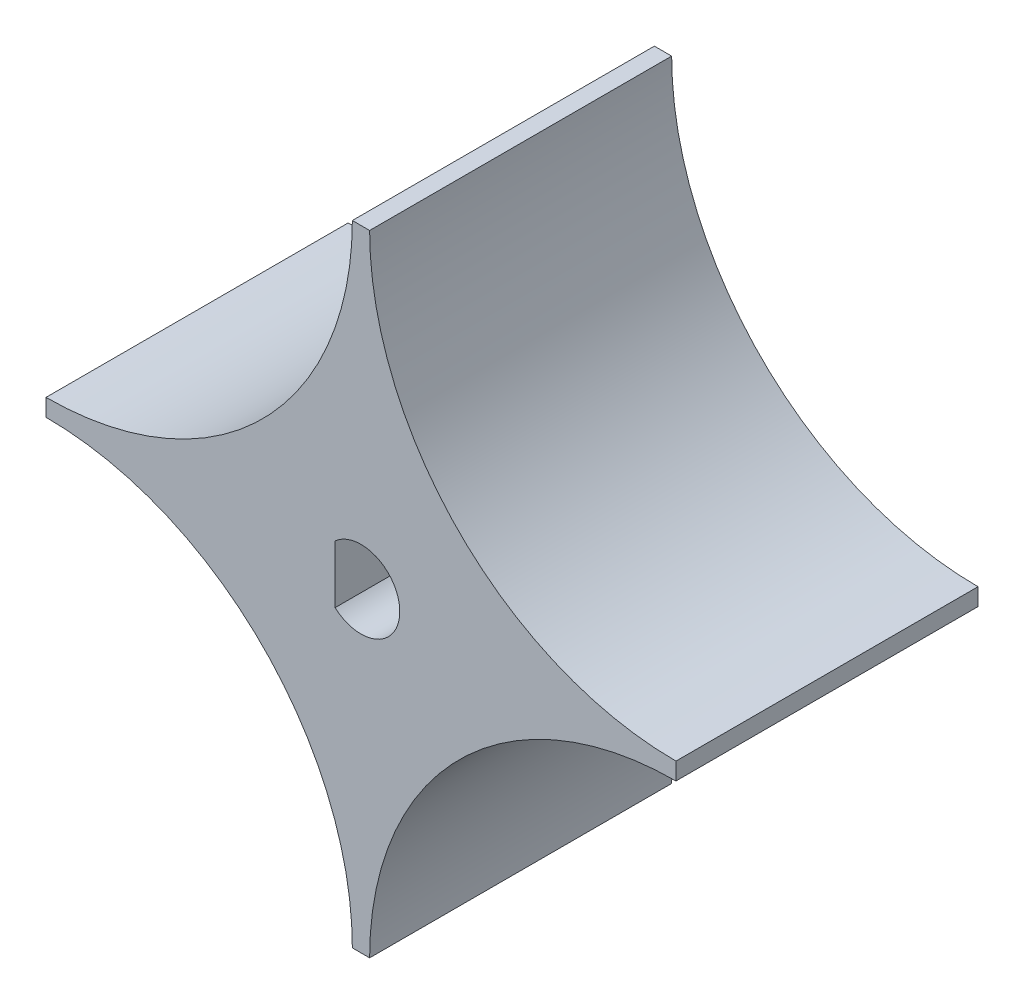
from build123d import *

# Parameters (mm, degrees)
BOSS_EXTRUDE2_DEPTH = 33
CUT_EXTRUDE1_DEPTH  = 10
CUT_EXTRUDE2_START  = -10
CUT_EXTRUDE2_DEPTH  = 10
BOSS_EXTRUDE3_START = 2
BOSS_EXTRUDE3_DEPTH = 2


with BuildPart() as part:
    # Sketch4 → Boss-Extrude2 (new body)
    with BuildSketch(Plane.XY):
        with BuildLine():
            Line((-23.886710504, -14.723007323), (-23.886710504, -16.723007323))
            ThreePointArc((-23.886710504, -16.723007323), (1.215580228, -27.120716591), (11.613289496, -52.223007323))
            Line((11.613289496, -52.223007323), (13.613289496, -52.223007323))
            ThreePointArc((13.613289496, -52.223007323), (24.010998764, -27.120716591), (49.113289496, -16.723007323))
            Line((49.113289496, -16.723007323), (49.113289496, -14.723007323))
            ThreePointArc((49.113289496, -14.723007323), (24.010998764, -4.325298055), (13.613289496, 20.776992677))
            Line((13.613289496, 20.776992677), (11.613289496, 20.776992677))
            ThreePointArc((11.613289496, 20.776992677), (1.215580228, -4.325298055), (-23.886710504, -14.723007323))
        make_face()
    extrude(amount=BOSS_EXTRUDE2_DEPTH)

    # Sketch5 → Cut-Extrude1 (cut)
    with BuildSketch(Plane.XY.offset(33)):
        with BuildLine():
            Line((9.613289496, -12.368905356), (9.613289496, -19.077109289))
            ThreePointArc((9.613289496, -19.077109289), (17.113289496, -15.723007323), (9.613289496, -12.368905356))
        make_face()
    extrude(amount=-CUT_EXTRUDE1_DEPTH, mode=Mode.SUBTRACT)

    # Sketch6 → Cut-Extrude2 (cut)
    with BuildSketch(Plane(origin=(0, 0, 0), x_dir=(-1, 0, 0), z_dir=(0, 0, -1)).offset(CUT_EXTRUDE2_START)):
        with BuildLine():
            Line((-15.613289496, -12.368905356), (-15.613289496, -19.077109289))
            ThreePointArc((-15.613289496, -19.077109289), (-8.113289496, -15.723007323), (-15.613289496, -12.368905356))
        make_face()
    extrude(amount=CUT_EXTRUDE2_DEPTH, mode=Mode.SUBTRACT)

    # Sketch8 → Boss-Extrude3 (add)
    with BuildSketch(Plane(origin=(0, 0, 0), x_dir=(-1, 0, 0), z_dir=(0, 0, -1)).offset(BOSS_EXTRUDE3_START)):
        with BuildLine():
            Line((-11.613289496, 20.776992677), (-13.613289496, 20.776992677))
            ThreePointArc((-13.613289496, 20.776992677), (-24.010998764, -4.325298055), (-49.113289496, -14.723007323))
            Line((-49.113289496, -14.723007323), (-49.113289496, -16.723007323))
            ThreePointArc((-49.113289496, -16.723007323), (-24.010998764, -27.120716591), (-13.613289496, -52.223007323))
            Line((-13.613289496, -52.223007323), (-11.613289496, -52.223007323))
            ThreePointArc((-11.613289496, -52.223007323), (-1.215580228, -27.120716591), (23.886710504, -16.723007323))
            Line((23.886710504, -16.723007323), (23.886710504, -14.723007323))
            ThreePointArc((23.886710504, -14.723007323), (-1.215580228, -4.325298055), (-11.613289496, 20.776992677))
        make_face()
        with BuildLine():
            Line((-15.613289496, -12.368905356), (-15.613289496, -19.077109289))
            ThreePointArc((-15.613289496, -19.077109289), (-8.113289496, -15.723007323), (-15.613289496, -12.368905356))
        make_face(mode=Mode.SUBTRACT)
    extrude(amount=-BOSS_EXTRUDE3_DEPTH)


solid = part.part
